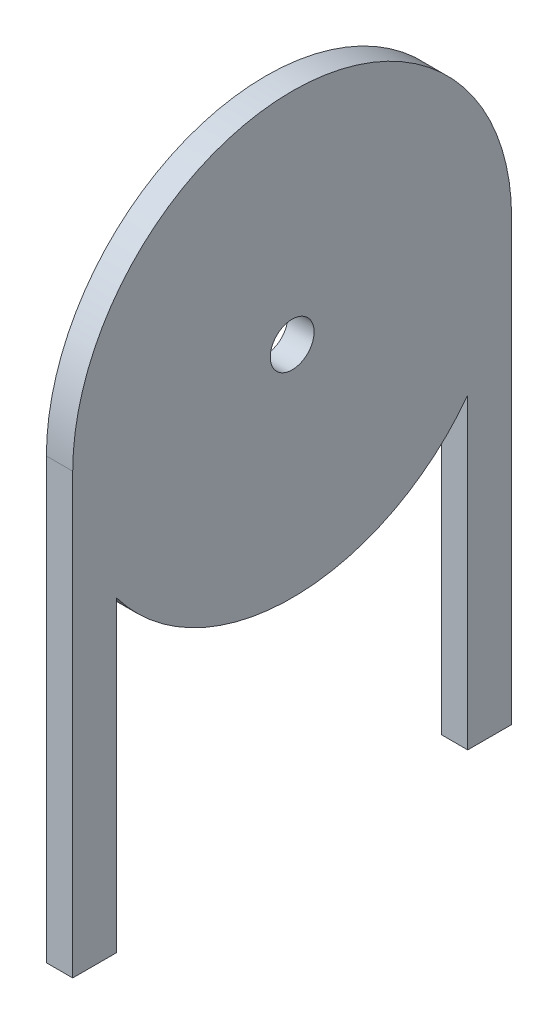
from build123d import *

# Parameters (mm, degrees)
SKETCH1_R           = 2.5
BOSS_EXTRUDE1_DEPTH = 3


with BuildPart() as part:
    # Sketch1 → Boss-Extrude1 (new body)
    with BuildSketch(Plane(origin=(0, 0, 0), x_dir=(0, 0, -1), z_dir=(1, 0, 0))):
        with BuildLine():
            Line((-20, -50), (-20, -15))
            ThreePointArc((-20, -15), (0, -25), (20, -15))
            Line((20, -15), (20, -50))
            Line((20, -50), (25, -50))
            Line((25, -50), (25, 0))
            ThreePointArc((25, 0), (0, 25), (-25, 0))
            Line((-25, 0), (-25, -50))
            Line((-25, -50), (-20, -50))
        make_face()
        Circle(SKETCH1_R, mode=Mode.SUBTRACT)
    extrude(amount=BOSS_EXTRUDE1_DEPTH)


solid = part.part
